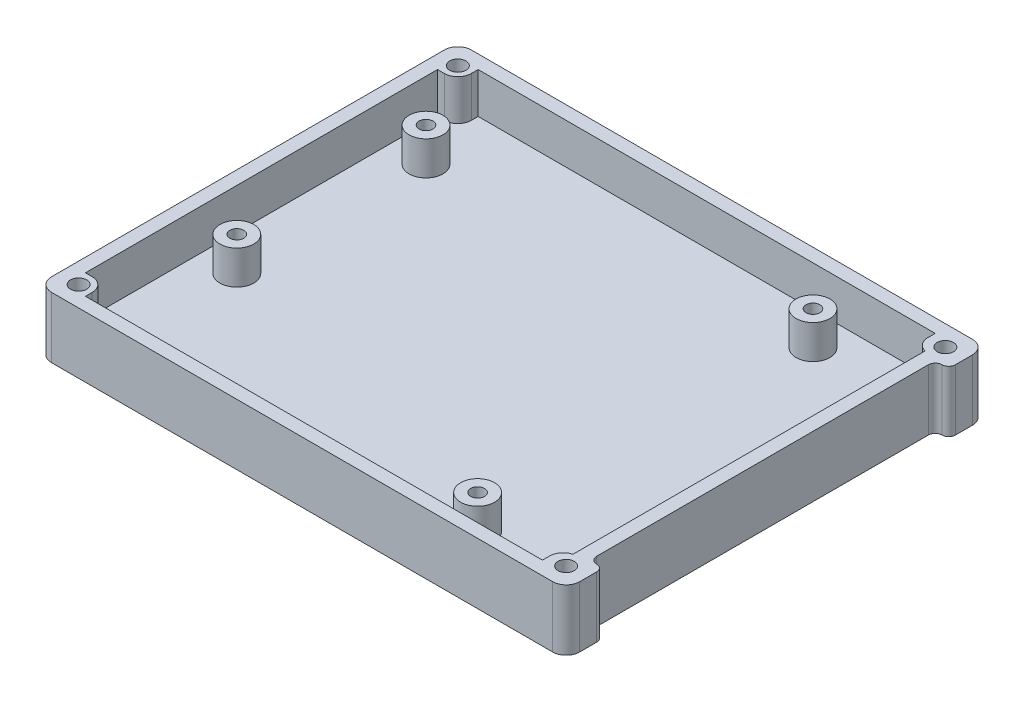
from build123d import *

# Parameters (mm, degrees)
SKETCH1_R                                           = 2.5
BOSS_EXTRUDE1_DEPTH                                 = 5
BOSS_EXTRUDE1_2_DEPTH                               = 5
BOSS_EXTRUDE1_3_DEPTH                               = 5
BOSS_EXTRUDE1_4_DEPTH                               = 5
M2_5_TAPPED_HOLE1_AT_2_COUNT                        = 2
M2_5_TAPPED_HOLE1_AT_2_PITCH                        = 27.94
M2_5_TAPPED_HOLE1_AT_3_COUNT                        = 2
M2_5_TAPPED_HOLE1_AT_3_PITCH                        = 52.317218007
M2_5_TAPPED_HOLE1_AT_4_COUNT                        = 2
M2_5_TAPPED_HOLE1_AT_4_PITCH                        = 66.671976122
BOSS_EXTRUDE2_DEPTH                                 = 3
BOSS_EXTRUDE3_DEPTH                                 = 6
FILLET5_R                                           = 2
CSK_FOR_M2_COUNTERSUNK_FLAT_HEAD_SCREW1_D           = 2.4
CSK_FOR_M2_COUNTERSUNK_FLAT_HEAD_SCREW1_CSINK_D     = 4.4
CSK_FOR_M2_COUNTERSUNK_FLAT_HEAD_SCREW1_CSINK_ANGLE = 90
FILLET6_R                                           = 2
FILLET7_R                                           = 1


# Some blends are built 0.0001 mm under size
with BuildPart() as part:
    # Sketch1 → Boss-Extrude1 (new body)
    with BuildSketch(Plane(origin=(0, 0, 0), x_dir=(1, 0, 0), z_dir=(0, 1, 0))):
        with Locations(Location((-31.75, 19.05, 0), (0, 0, 270))):
            Circle(SKETCH1_R)
    extrude(amount=-BOSS_EXTRUDE1_DEPTH)

    # Sketch13 → M2.5 Tapped Hole1 (revolve, cut)
    with BuildSketch(Plane(origin=(-31.75, 0, -19.05), x_dir=(0, 0, 1), z_dir=(1, 0, 0))):
        Polygon((0, 0), (0, 6.965882135), (1.025, 6.35), (1.025, 0), align=None)
    m2_5_tapped_hole1 = revolve(axis=Axis((-31.75, 6.35, -19.05), (0, -1, 0)), mode=Mode.SUBTRACT)



with BuildPart() as body_2:
    # Sketch1 → Boss-Extrude1 2 (new body)
    with BuildSketch(Plane(origin=(0, 0, 0), x_dir=(1, 0, 0), z_dir=(0, 1, 0))):
        with Locations(Location((-31.75, -8.89, 0), (0, 0, 270))):
            Circle(SKETCH1_R)
    extrude(amount=-BOSS_EXTRUDE1_2_DEPTH)

    # M2.5 Tapped Hole1 at 2: M2.5 Tapped Hole1 ×2
    with Locations(*[(0, 0, i * M2_5_TAPPED_HOLE1_AT_2_PITCH) for i in range(1, M2_5_TAPPED_HOLE1_AT_2_COUNT)]):
        add(m2_5_tapped_hole1, mode=Mode.SUBTRACT)


with BuildPart() as body_3:
    # Sketch1 → Boss-Extrude1 3 (new body)
    with BuildSketch(Plane(origin=(0, 0, 0), x_dir=(1, 0, 0), z_dir=(0, 1, 0))):
        with Locations(Location((20.32, 24.13, 0), (0, 0, 270))):
            Circle(SKETCH1_R)
    extrude(amount=-BOSS_EXTRUDE1_3_DEPTH)

    # M2.5 Tapped Hole1 at 3: M2.5 Tapped Hole1 ×2
    with Locations(*[Vector(0.9952746339256161, 0, -0.097099964285426) * (i * M2_5_TAPPED_HOLE1_AT_3_PITCH) for i in range(1, M2_5_TAPPED_HOLE1_AT_3_COUNT)]):
        add(m2_5_tapped_hole1, mode=Mode.SUBTRACT)


with BuildPart() as body_4:
    # Sketch1 → Boss-Extrude1 4 (new body)
    with BuildSketch(Plane(origin=(0, 0, 0), x_dir=(1, 0, 0), z_dir=(0, 1, 0))):
        with Locations(Location((19.05, -24.13, 0), (0, 0, 270))):
            Circle(SKETCH1_R)
    extrude(amount=-BOSS_EXTRUDE1_4_DEPTH)

    # M2.5 Tapped Hole1 at 4: M2.5 Tapped Hole1 ×2
    with Locations(*[Vector(0.7619393177594593, 0, 0.6476484200955406) * (i * M2_5_TAPPED_HOLE1_AT_4_PITCH) for i in range(1, M2_5_TAPPED_HOLE1_AT_4_COUNT)]):
        add(m2_5_tapped_hole1, mode=Mode.SUBTRACT)


with BuildPart() as part_1:
    add(part.part)

    add(body_2.part)  # Boss-Extrude2 merges body 2

    add(body_3.part)  # Boss-Extrude2 merges body 3

    add(body_4.part)  # Boss-Extrude2 merges body 4
    # Sketch3 → Boss-Extrude2 (add)
    with BuildSketch(Plane.XZ.offset(5)):
        Polygon((-39, 31), (39, 31), (39, 25.5), (37, 25.5), (37, -25.5), (39, -25.5), (39, -31), (-39, -31), align=None)
    extrude(amount=BOSS_EXTRUDE2_DEPTH)

    # Sketch4 → Boss-Extrude3 (add)
    with BuildSketch(Plane(origin=(0, -5, 0), x_dir=(1, 0, 0), z_dir=(0, 1, 0))):
        Polygon((-39, -31), (39, -31), (39, -25.5), (37, -25.5), (37, 25.5), (39, 25.5), (39, 31), (-39, 31), align=None)
        Polygon((-34, -29), (33.5, -29), (33.5, -26), (35, -26), (35, 26), (33.5, 26), (33.5, 29), (-34, 29), (-34, 26), (-37, 26), (-37, -26), (-34, -26), align=None, mode=Mode.SUBTRACT)
    extrude(amount=BOSS_EXTRUDE3_DEPTH)

    # Fillet5
    # the kernel refuses this fillet: 2 mm, written as the material it takes off along each edge
    with BuildSketch(Plane(origin=(33.5, -5, 26), x_dir=(0, 0, 1), z_dir=(0, 1, 0))) as fillet5_piece_1:
        with BuildLine():
            CenterArc((1.936491673, 2), FILLET5_R, 194.477512186, 75.522487814)
            Line((0, 1.5), (-0.038729833, 1.49))
            ThreePointArc((-0.038729833, 1.49), (-0.04, 0.75), (-0.04, 0))
            Line((-0.04, 0), (0, -0.04))
            Line((0, -0.04), (1.936491673, -0.04))
            Line((1.936491673, -0.04), (1.936491673, 0))
        make_face()
    extrude(amount=10.841229183, mode=Mode.SUBTRACT)
    with BuildSketch(Plane(origin=(33.5, -5, -26), x_dir=(1, 0, 0), z_dir=(0, 1, 0))) as fillet5_piece_2:
        with BuildLine():
            CenterArc((2, 1.936491673), FILLET5_R, 180, 75.522487814)
            Line((0, 1.936491673), (-0.04, 1.936491673))
            Line((-0.04, 1.936491673), (-0.04, 0))
            Line((-0.04, 0), (0, -0.04))
            ThreePointArc((0, -0.04), (0.75, -0.04), (1.49, -0.038729833))
            Line((1.49, -0.038729833), (1.5, 0))
        make_face()
    extrude(amount=10.841229183, mode=Mode.SUBTRACT)
    with BuildSketch(Plane(origin=(-34, -5, -26), x_dir=(0, 0, -1), z_dir=(0, 1, 0)), Plane(origin=(-34, -5, 26), x_dir=(-1, 0, 0), z_dir=(0, 1, 0))) as fillet5_piece_3:
        with BuildLine():
            CenterArc((FILLET5_R, FILLET5_R), FILLET5_R, 180, 90)
            Line((0, FILLET5_R), (-FILLET5_R * 0.02, FILLET5_R))
            Line((-FILLET5_R * 0.02, FILLET5_R), (-FILLET5_R * 0.02, -FILLET5_R * 0.02))
            Line((-FILLET5_R * 0.02, -FILLET5_R * 0.02), (FILLET5_R, -FILLET5_R * 0.02))
            Line((FILLET5_R, -FILLET5_R * 0.02), (FILLET5_R, 0))
        make_face()
    extrude(amount=11, mode=Mode.SUBTRACT)

    # CSK for M2 Countersunk Flat Head Screw1 (through all)
    with Locations(Plane(origin=(0, -8, 0), x_dir=(-1, 0, 0), z_dir=(0, -1, 0))):
        with Locations((-36, 28), (36, 28), (36, -28), (-36, -28)):
            CounterSinkHole(CSK_FOR_M2_COUNTERSUNK_FLAT_HEAD_SCREW1_D / 2, CSK_FOR_M2_COUNTERSUNK_FLAT_HEAD_SCREW1_CSINK_D / 2, counter_sink_angle=CSK_FOR_M2_COUNTERSUNK_FLAT_HEAD_SCREW1_CSINK_ANGLE)

    # Fillet6
    fillet6_edges = [part_1.edges().sort_by_distance(p)[0] for p in [
        (39, -3.5, -31),
        (39, -3.5, 31),
        (-39, -3.5, 31),
        (-39, -3.5, -31),
    ]]
    fillet(fillet6_edges, radius=FILLET6_R)

    # Fillet7
    fillet7_edges = [part_1.edges().sort_by_distance(p)[0] for p in [
        (37, -3.5, -25.5),
        (37, -3.5, 25.5),
    ]]
    fillet(fillet7_edges, radius=FILLET7_R)
    fillet7_2_edges = [part_1.edges().sort_by_distance(p)[0] for p in [
        (39, -3.5, -25.5),
        (39, -3.5, 25.5),
    ]]
    fillet(fillet7_2_edges, radius=FILLET7_R - 0.0001)  # a hair under: the kernel refuses the full size


solid = part_1.part
